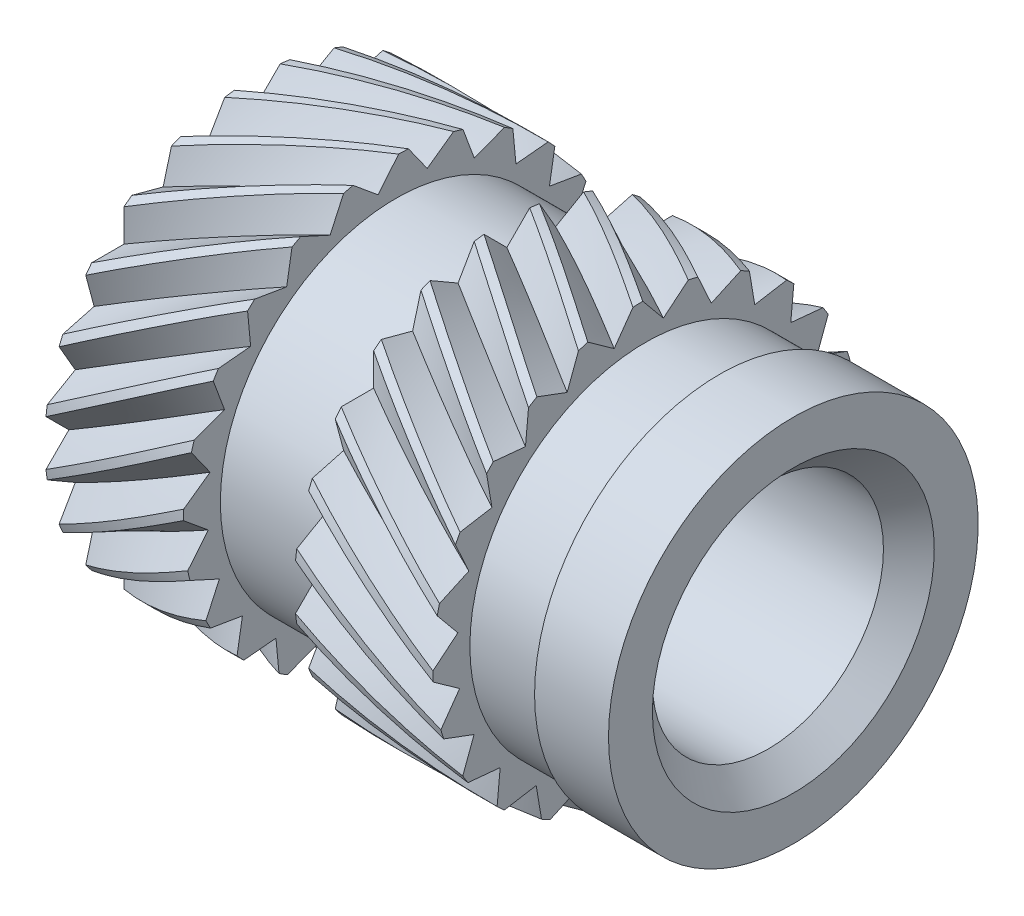
from build123d import *

# Parameters (mm, degrees)
SWEEP_1_PITCH            = 22
SWEEP_2_PITCH            = 22
PATTERN_CIRCULAR_1_COUNT = 24


with BuildPart() as part:
    # Эскиз1 → Повернуть1 (revolve)
    with BuildSketch(Plane.XY, mode=Mode.PRIVATE) as revolve_1_sk:
        Polygon((0, 1), (0, 2.3), (1.5, 2.3), (1.5, 1.9), (2.7, 1.9), (2.7, 2.3), (4.2, 2.3), (4.2, 1.9), (5, 1.9), (5, 2), (5.8, 2), (5.8, 1), align=None)
    revolve(revolve_1_sk.sketch.rotate(Axis((0, 0, 0), (1, 0, 0)), 90), axis=Axis((0, 0, 0), (1, 0, 0)))

    # Эскиз2 → Отверстие обработанное метчиком M31 (revolve, cut)
    with BuildSketch(Plane.ZX):
        Polygon((0, 0), (0, 5.8), (1.525, 5.8), (1.25, 5.525), (1.25, 0.275), (1.525, 0), align=None)
    revolve(axis=Axis((-6.35, 0, 0), (1, 0, 0)), mode=Mode.SUBTRACT)

    # Вырез-По траектории1: the profile of Эскиз5 screwed along a left-hand helix of 0.08 turns, 20 arcs to a turn; built about Z, then put on its axis
    sweep_1_z = Axis((0, 0, 0), (0, 0, 1))
    sweep_1_corners = [(2.286646015, -0.247487373, 0), (2.039158642, 0, 0), (2.286646015, 0.247487373, 0)]
    with BuildLine(mode=Mode.PRIVATE) as sweep_1_profile:
        Line(sweep_1_corners[0], sweep_1_corners[1])
        Line(sweep_1_corners[1], sweep_1_corners[2])
        ThreePointArc((2.286646015, 0.247487373, 0), (2.3, 0, 0), (2.286646015, -0.247487373, 0))
    sweep_1_cap = Face(sweep_1_profile.wire())
    sweep_1_arcs = [((2.286646015, 0.247487373, 0), (2.313431972, 0, 0), (2.286646015, -0.247487373, 0), (1, 0.994193919763402, 1))]  # start, shoulder, end, weights
    sweep_1_turn_angles = [0, -9, -18, -23.4, -28.8]
    sweep_1_turn_weights = [1, 0.9876883405951378, 1, 0.9955619646030799, 1]
    sweep_1_turn_rails = [Edge.make_bspline([Vector(p[0], p[1], 0).rotate(sweep_1_z, sweep_1_turn_angles[k]) / sweep_1_turn_weights[k] + Vector(0, 0, p[2] + -SWEEP_1_PITCH * sweep_1_turn_angles[k] / 360) for k in range(5)], [0, 0, 0, 1, 1, 2, 2, 2], 2, sweep_1_turn_weights) for p in sweep_1_corners]
    sweep_1_turn_sides = [*[Face.make_surface_from_curves(sweep_1_turn_rails[p[0]], sweep_1_turn_rails[p[1]]) for p in [(0, 1), (1, 2)]], *[Face.make_bezier_surface([[Vector(p[j][0], p[j][1], 0).rotate(sweep_1_z, sweep_1_turn_angles[2 * i + k]) / sweep_1_turn_weights[2 * i + k] + Vector(0, 0, p[j][2] + -SWEEP_1_PITCH * sweep_1_turn_angles[2 * i + k] / 360) for k in range(3)] for j in range(3)], [[p[3][j] * sweep_1_turn_weights[2 * i + k] for k in range(3)] for j in range(3)]) for p in sweep_1_arcs for i in range(2)]]
    sweep_1 = Plane(origin=(0, 0, 0), x_dir=(0, 0, 1), z_dir=(1, 0, 0)) * Solid(Shell([*sweep_1_turn_sides, sweep_1_cap, sweep_1_cap.rotate(sweep_1_z, -28.8).moved(Location((0, 0, -SWEEP_1_PITCH * -28.8 / 360)))]))
    add(sweep_1, mode=Mode.SUBTRACT)

    # Вырез-По траектории2: the profile of Эскиз7 screwed along a right-hand helix of 0.08 turns, 20 arcs to a turn; built about Z, then put on its axis
    sweep_2_z = Axis((0, 0, 0), (0, 0, 1))
    sweep_2_corners = [(2.286646015, -0.247487373, 0), (2.039158642, 0, 0), (2.286646015, 0.247487373, 0)]
    with BuildLine(mode=Mode.PRIVATE) as sweep_2_profile:
        Line(sweep_2_corners[0], sweep_2_corners[1])
        Line(sweep_2_corners[1], sweep_2_corners[2])
        ThreePointArc((2.286646015, 0.247487373, 0), (2.3, 0, 0), (2.286646015, -0.247487373, 0))
    sweep_2_cap = Face(sweep_2_profile.wire())
    sweep_2_arcs = [((2.286646015, 0.247487373, 0), (2.313431972, 0, 0), (2.286646015, -0.247487373, 0), (1, 0.994193919763402, 1))]  # start, shoulder, end, weights
    sweep_2_turn_angles = [0, 9, 18, 23.4, 28.8]
    sweep_2_turn_weights = [1, 0.9876883405951378, 1, 0.9955619646030799, 1]
    sweep_2_turn_rails = [Edge.make_bspline([Vector(p[0], p[1], 0).rotate(sweep_2_z, sweep_2_turn_angles[k]) / sweep_2_turn_weights[k] + Vector(0, 0, p[2] + SWEEP_2_PITCH * sweep_2_turn_angles[k] / 360) for k in range(5)], [0, 0, 0, 1, 1, 2, 2, 2], 2, sweep_2_turn_weights) for p in sweep_2_corners]
    sweep_2_turn_sides = [*[Face.make_surface_from_curves(sweep_2_turn_rails[p[0]], sweep_2_turn_rails[p[1]]) for p in [(0, 1), (1, 2)]], *[Face.make_bezier_surface([[Vector(p[j][0], p[j][1], 0).rotate(sweep_2_z, sweep_2_turn_angles[2 * i + k]) / sweep_2_turn_weights[2 * i + k] + Vector(0, 0, p[j][2] + SWEEP_2_PITCH * sweep_2_turn_angles[2 * i + k] / 360) for k in range(3)] for j in range(3)], [[p[3][j] * sweep_2_turn_weights[2 * i + k] for k in range(3)] for j in range(3)]) for p in sweep_2_arcs for i in range(2)]]
    sweep_2 = Plane(origin=(2.7, 0, 0), x_dir=(0, 0, 1), z_dir=(1, 0, 0)) * Solid(Shell([*sweep_2_turn_sides, sweep_2_cap, sweep_2_cap.rotate(sweep_2_z, 28.8).moved(Location((0, 0, SWEEP_2_PITCH * 28.8 / 360)))]))
    add(sweep_2, mode=Mode.SUBTRACT)

    # Круговой массив1: Вырез-По траектории1, Вырез-По траектории2 ×24 about axis
    pattern_circular_1_axis = Axis((0, 0, 0), (-1, 0, 0))
    add([sweep_1.rotate(pattern_circular_1_axis, i * 360 / PATTERN_CIRCULAR_1_COUNT) for i in range(1, PATTERN_CIRCULAR_1_COUNT)], mode=Mode.SUBTRACT)
    add([sweep_2.rotate(pattern_circular_1_axis, i * 360 / PATTERN_CIRCULAR_1_COUNT) for i in range(1, PATTERN_CIRCULAR_1_COUNT)], mode=Mode.SUBTRACT)


solid = part.part
